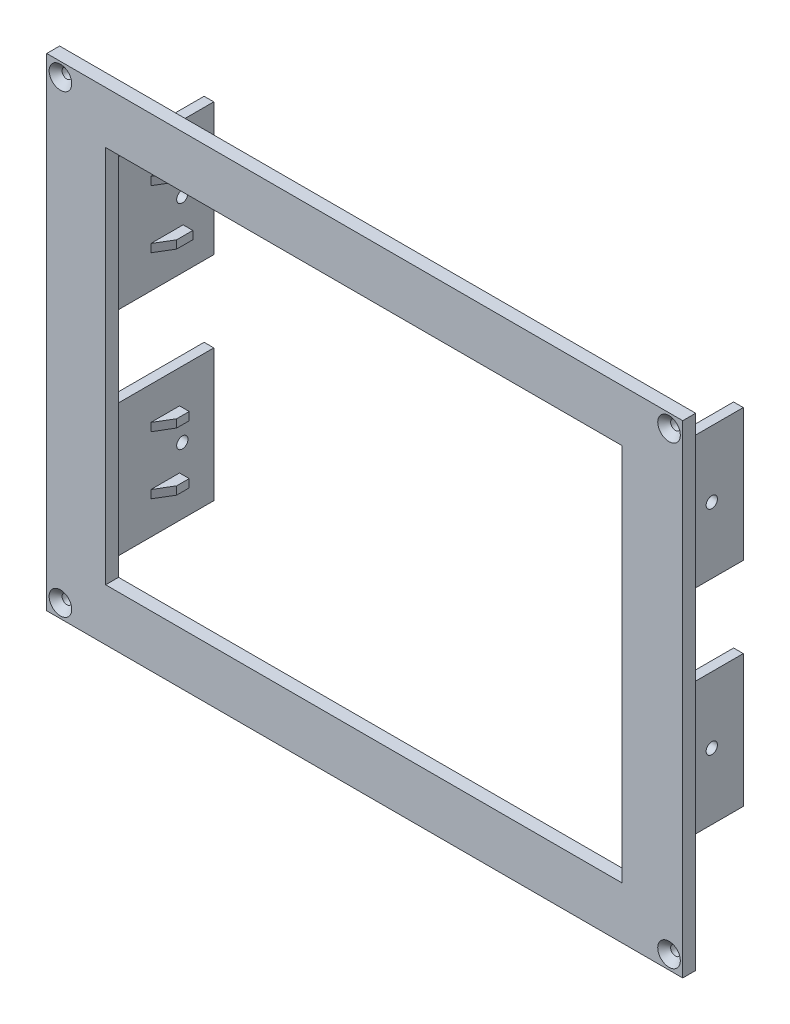
from build123d import *
from OCP.BRepFilletAPI import BRepFilletAPI_MakeChamfer

# Parameters (mm, degrees)
ESQUISSE1_W             = 197
ESQUISSE1_H             = 149.5
BOSS_EXTRU_1_DEPTH      = 4
ESQUISSE3_R             = 1.5
ENL_V_MAT_EXTRU_2_DEPTH = 4
CHANFREIN1_SIZE         = 2
ESQUISSE4_W             = 160
ESQUISSE4_H             = 117.3
ENL_V_MAT_EXTRU_3_DEPTH = 10
ESQUISSE5_W             = 3
ESQUISSE5_H             = 41
BOSS_EXTRU_2_DEPTH      = 30
ESQUISSE6_W             = 10
ESQUISSE6_H             = 2.5
ESQUISSE6_W_2           = 8.882781921
BOSS_EXTRU_3_DEPTH      = 3
ESQUISSE7_W             = 10
ESQUISSE7_H             = 2.5
BOSS_EXTRU_4_DEPTH      = 3
CHANFREIN2_SIZE         = 3
CHANFREIN2_SIZE_2       = 5
ESQUISSE8_R             = 1.75
ENL_V_MAT_EXTRU_4_DEPTH = 210


with BuildPart() as part:
    # Esquisse1 → Boss.-Extru.1 (new body)
    with BuildSketch(Plane.XY):
        with Locations((98.5, 74.75)):
            Rectangle(ESQUISSE1_W, ESQUISSE1_H)
    extrude(amount=BOSS_EXTRU_1_DEPTH)

    # Esquisse3 → Enlèv. mat.-Extru.2 (cut)
    with BuildSketch(Plane.XY.offset(4)):
        with Locations((4.25, 145.25)):
            Circle(ESQUISSE3_R)
        with Locations((4.25, 4.25)):
            Circle(ESQUISSE3_R)
        with Locations((192.75, 4.25)):
            Circle(ESQUISSE3_R)
        with Locations((192.75, 145.25)):
            Circle(ESQUISSE3_R)
    extrude(amount=-ENL_V_MAT_EXTRU_2_DEPTH, mode=Mode.SUBTRACT)

    # Chanfrein1
    chanfrein1_edges = [part.edges().sort_by_distance(p)[0] for p in [
        (2.75, 145.25, 4),
        (2.75, 4.25, 4),
        (191.25, 4.25, 4),
        (191.25, 145.25, 4),
    ]]
    chamfer(chanfrein1_edges, length=CHANFREIN1_SIZE)

    # Esquisse4 → Enlèv. mat.-Extru.3 (cut)
    with BuildSketch(Plane.XY.offset(4)):
        with Locations((98.25, 74.75)):
            Rectangle(ESQUISSE4_W, ESQUISSE4_H)
    extrude(amount=-ENL_V_MAT_EXTRU_3_DEPTH, mode=Mode.SUBTRACT)

    # Esquisse5 → Boss.-Extru.2 (add)
    with BuildSketch(Plane(origin=(0, 0, 0), x_dir=(-1, 0, 0), z_dir=(0, 0, -1))):
        with Locations((-180.25, 107.9)):
            Rectangle(ESQUISSE5_W, ESQUISSE5_H)
        with Locations((-180.25, 41.9)):
            Rectangle(ESQUISSE5_W, ESQUISSE5_H)
        with Locations((-16.25, 107.9)):
            Rectangle(ESQUISSE5_W, ESQUISSE5_H)
        with Locations((-16.25, 41.9)):
            Rectangle(ESQUISSE5_W, ESQUISSE5_H)
    extrude(amount=BOSS_EXTRU_2_DEPTH)

    # Esquisse6 → Boss.-Extru.3 (add)
    with BuildSketch(Plane(origin=(17.75, 0, 0), x_dir=(0, 0, -1), z_dir=(1, 0, 0))):
        with Locations((15.5, 116.9)):
            Rectangle(ESQUISSE6_W, ESQUISSE6_H)
        with Locations((15.5, 98.9)):
            Rectangle(ESQUISSE6_W, ESQUISSE6_H)
        with Locations((14.941390961, 50.9)):
            Rectangle(ESQUISSE6_W_2, ESQUISSE6_H)
        with Locations((14.941390961, 32.9)):
            Rectangle(ESQUISSE6_W_2, ESQUISSE6_H)
    extrude(amount=BOSS_EXTRU_3_DEPTH)

    # Esquisse7 → Boss.-Extru.4 (add)
    with BuildSketch(Plane.ZY.offset(-178.75)):
        with Locations((-15.5, 32.9)):
            Rectangle(ESQUISSE7_W, ESQUISSE7_H)
        with Locations((-15.5, 50.9)):
            Rectangle(ESQUISSE7_W, ESQUISSE7_H)
        with Locations((-15.5, 98.9)):
            Rectangle(ESQUISSE7_W, ESQUISSE7_H)
        with Locations((-15.5, 116.9)):
            Rectangle(ESQUISSE7_W, ESQUISSE7_H)
    extrude(amount=BOSS_EXTRU_4_DEPTH)

    # Chanfrein2
    chanfrein2_edges_1 = [part.edges().sort_by_distance(p)[0] for p in [
        (20.75, 98.9, -10.5),
    ]]
    chanfrein2_side_1 = [part.faces().sort_by_distance(p)[0] for p in [
        (20.69, 98.9, -10.5),
    ]]
    chanfrein2_edges_2 = [part.edges().sort_by_distance(p)[0] for p in [
        (20.75, 116.9, -10.5),
    ]]
    chanfrein2_side_2 = [part.faces().sort_by_distance(p)[0] for p in [
        (20.69, 116.9, -10.5),
    ]]
    chanfrein2_edges_3 = [part.edges().sort_by_distance(p)[0] for p in [
        (20.75, 32.9, -10.5),
    ]]
    chanfrein2_side_3 = [part.faces().sort_by_distance(p)[0] for p in [
        (20.69, 32.9, -10.5),
    ]]
    chanfrein2_edges_4 = [part.edges().sort_by_distance(p)[0] for p in [
        (20.75, 50.9, -10.5),
    ]]
    chanfrein2_side_4 = [part.faces().sort_by_distance(p)[0] for p in [
        (20.69, 50.9, -10.5),
    ]]
    chanfrein2_edges_5 = [part.edges().sort_by_distance(p)[0] for p in [
        (175.75, 116.9, -10.5),
    ]]
    chanfrein2_side_5 = [part.faces().sort_by_distance(p)[0] for p in [
        (175.81, 116.9, -10.5),
    ]]
    chanfrein2_edges_6 = [part.edges().sort_by_distance(p)[0] for p in [
        (175.75, 98.9, -10.5),
    ]]
    chanfrein2_side_6 = [part.faces().sort_by_distance(p)[0] for p in [
        (175.81, 98.9, -10.5),
    ]]
    chanfrein2_edges_7 = [part.edges().sort_by_distance(p)[0] for p in [
        (175.75, 50.9, -10.5),
    ]]
    chanfrein2_side_7 = [part.faces().sort_by_distance(p)[0] for p in [
        (175.81, 50.9, -10.5),
    ]]
    chanfrein2_edges_8 = [part.edges().sort_by_distance(p)[0] for p in [
        (175.75, 32.9, -10.5),
    ]]
    chanfrein2_side_8 = [part.faces().sort_by_distance(p)[0] for p in [
        (175.81, 32.9, -10.5),
    ]]
    chanfrein2 = BRepFilletAPI_MakeChamfer(part.part.solid().wrapped)
    for e in chanfrein2_edges_1:
        chanfrein2.Add(CHANFREIN2_SIZE - 0.0001, CHANFREIN2_SIZE_2 - 0.0001, e.wrapped, chanfrein2_side_1[0].wrapped)
    for e in chanfrein2_edges_2:
        chanfrein2.Add(CHANFREIN2_SIZE - 0.0001, CHANFREIN2_SIZE_2 - 0.0001, e.wrapped, chanfrein2_side_2[0].wrapped)
    for e in chanfrein2_edges_3:
        chanfrein2.Add(CHANFREIN2_SIZE - 0.0001, CHANFREIN2_SIZE_2 - 0.0001, e.wrapped, chanfrein2_side_3[0].wrapped)
    for e in chanfrein2_edges_4:
        chanfrein2.Add(CHANFREIN2_SIZE - 0.0001, CHANFREIN2_SIZE_2 - 0.0001, e.wrapped, chanfrein2_side_4[0].wrapped)
    for e in chanfrein2_edges_5:
        chanfrein2.Add(CHANFREIN2_SIZE - 0.0001, CHANFREIN2_SIZE_2 - 0.0001, e.wrapped, chanfrein2_side_5[0].wrapped)
    for e in chanfrein2_edges_6:
        chanfrein2.Add(CHANFREIN2_SIZE - 0.0001, CHANFREIN2_SIZE_2 - 0.0001, e.wrapped, chanfrein2_side_6[0].wrapped)
    for e in chanfrein2_edges_7:
        chanfrein2.Add(CHANFREIN2_SIZE - 0.0001, CHANFREIN2_SIZE_2 - 0.0001, e.wrapped, chanfrein2_side_7[0].wrapped)
    for e in chanfrein2_edges_8:
        chanfrein2.Add(CHANFREIN2_SIZE - 0.0001, CHANFREIN2_SIZE_2 - 0.0001, e.wrapped, chanfrein2_side_8[0].wrapped)
    add(Compound.cast(chanfrein2.Shape()), mode=Mode.REPLACE)  # a hair under: the kernel refuses the full size

    # Esquisse8 → Enlèv. mat.-Extru.4 (cut)
    with BuildSketch(Plane.ZY.offset(-14.75)):
        with Locations(Location((-20.25, 107.9, 0), (0, 0, 270))):
            Circle(ESQUISSE8_R)
        with Locations(Location((-20.25, 41.9, 0), (0, 0, 270))):
            Circle(ESQUISSE8_R)
    extrude(amount=-ENL_V_MAT_EXTRU_4_DEPTH, mode=Mode.SUBTRACT)


solid = part.part
